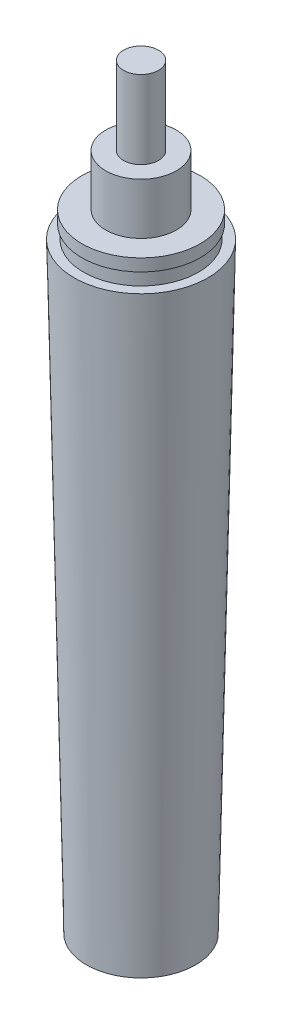
from build123d import *

# Parameters (mm, degrees)
SKETCH1_R           = 2.35
BOSS_EXTRUDE1_DEPTH = 10.5
SKETCH2_R           = 4.75
BOSS_EXTRUDE2_DEPTH = 6.9
SKETCH3_R           = 7.95
BOSS_EXTRUDE3_DEPTH = 1.64
SKETCH4_R           = 7.715
BOSS_EXTRUDE4_DEPTH = 1.8


# Read off the part's stored shape, not the designer's step: Loft1
with BuildPart() as part:
    # Sketch1 → Boss-Extrude1 (new body)
    with BuildSketch(Plane(origin=(0, 0, 0), x_dir=(1, 0, 0), z_dir=(0, 1, 0))):
        with Locations(Location((0, 0, 0), (0, 0, 90))):
            Circle(SKETCH1_R)
    extrude(amount=BOSS_EXTRUDE1_DEPTH)

    # Sketch2 → Boss-Extrude2 (add)
    with BuildSketch(Plane.XZ):
        with Locations(Location((0, 0, 0), (0, 0, 90))):
            Circle(SKETCH2_R)
    extrude(amount=BOSS_EXTRUDE2_DEPTH)

    # Sketch3 → Boss-Extrude3 (add)
    with BuildSketch(Plane.XZ.offset(6.9)):
        with Locations(Location((0, 0, 0), (0, 0, 270))):
            Circle(SKETCH3_R)
    extrude(amount=BOSS_EXTRUDE3_DEPTH)

    # Sketch4 → Boss-Extrude4 (add)
    with BuildSketch(Plane.XZ.offset(8.54)):
        with Locations(Location((0, 0, 0), (0, 0, 270))):
            Circle(SKETCH4_R)
    extrude(amount=BOSS_EXTRUDE4_DEPTH)

    # Loft1 outline → Loft1 (revolve)
    with BuildSketch(Plane.XY):
        Polygon((0, -10.34), (0, -91.19), (7.35, -91.19), (9, -10.34), align=None)
    revolve(axis=Axis((0, 0, 0), (0, 1, 0)))


solid = part.part
